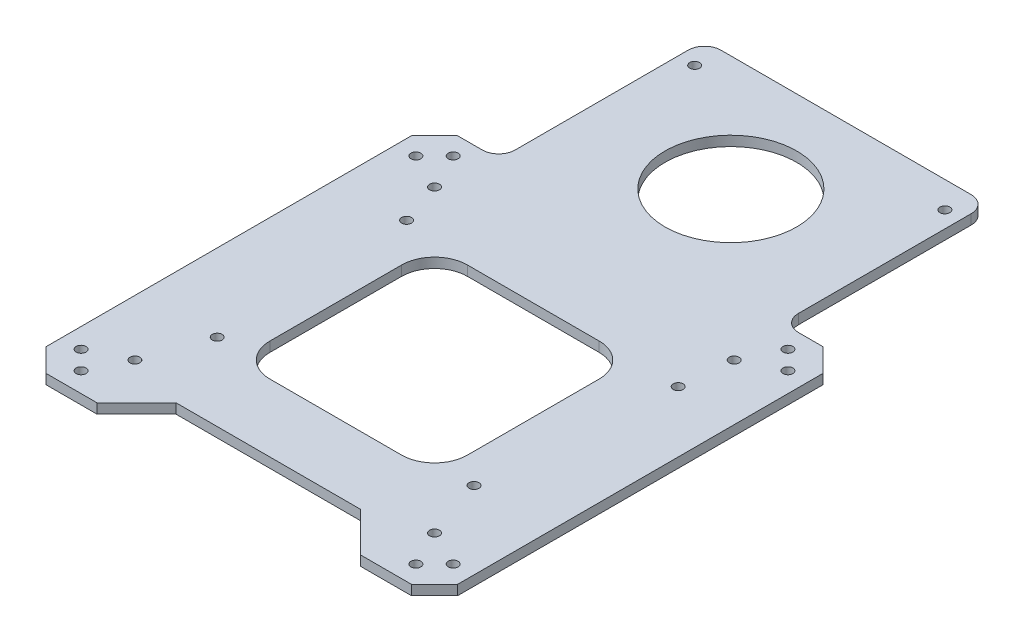
from build123d import *

# Parameters (mm, degrees)
SKETCH_1_R          = 1.5
EXTRUDE_1_DEPTH     = 3
CHAMFER_1_SIZE      = 7
FILLET_1_R          = 5
SKETCH_3_W          = 60
SKETCH_3_H          = 60
SKETCH_3_R          = 1.5
SKETCH_3_R_2        = 20
SKETCH_3_W_2        = 80
SKETCH_3_H_2        = 12
CUT_EXTRUDE_1_DEPTH = 3
FILLET_3_R          = 10
CHAMFER_2_SIZE      = 12
SKETCH_4_R          = 1.5
CUT_EXTRUDE_2_DEPTH = 10


with BuildPart() as part:
    # 草图1 → 凸台-拉伸1 (new body)
    with BuildSketch(Plane(origin=(0, 0, 0), x_dir=(1, 0, 0), z_dir=(0, 1, 0))):
        Polygon((-62.5, 62.5), (-62.5, -62.5), (62.5, -62.5), (62.5, 62.5), (43, 62.5), (43, 125), (-43, 125), (-43, 62.5), align=None)
        with Locations(Location((-56.5, -50.843145751, 0), (0, 0, 270))):
            Circle(SKETCH_1_R, mode=Mode.SUBTRACT)
        with Locations(Location((-50.843145751, -56.5, 0), (0, 0, 270))):
            Circle(SKETCH_1_R, mode=Mode.SUBTRACT)
        with Locations(Location((50.843145751, -56.5, 0), (0, 0, 270))):
            Circle(SKETCH_1_R, mode=Mode.SUBTRACT)
        with Locations(Location((56.5, -50.843145751, 0), (0, 0, 270))):
            Circle(SKETCH_1_R, mode=Mode.SUBTRACT)
        with Locations(Location((-56.5, 50.843145751, 0), (0, 0, 270))):
            Circle(SKETCH_1_R, mode=Mode.SUBTRACT)
        with Locations(Location((-50.843145751, 56.5, 0), (0, 0, 270))):
            Circle(SKETCH_1_R, mode=Mode.SUBTRACT)
        with Locations(Location((56.5, 50.843145751, 0), (0, 0, 270))):
            Circle(SKETCH_1_R, mode=Mode.SUBTRACT)
        with Locations(Location((50.843145751, 56.5, 0), (0, 0, 270))):
            Circle(SKETCH_1_R, mode=Mode.SUBTRACT)
        with Locations(Location((38, 117, 0), (0, 0, 270))):
            Circle(SKETCH_1_R, mode=Mode.SUBTRACT)
        with Locations(Location((-38, 117, 0), (0, 0, 270))):
            Circle(SKETCH_1_R, mode=Mode.SUBTRACT)
    extrude(amount=EXTRUDE_1_DEPTH)

    # 倒角1
    chamfer_1_edges = [part.edges().sort_by_distance(p)[0] for p in [
        (-62.5, 1.5, 62.5),
        (-62.5, 1.5, -62.5),
        (62.5, 1.5, -62.5),
        (62.5, 1.5, 62.5),
    ]]
    chamfer(chamfer_1_edges, length=CHAMFER_1_SIZE)

    # 圆角1
    fillet_1_edges = [part.edges().sort_by_distance(p)[0] for p in [
        (-43, 1.5, -62.5),
        (-43, 1.5, -125),
        (43, 1.5, -125),
        (43, 1.5, -62.5),
    ]]
    fillet(fillet_1_edges, radius=FILLET_1_R)

    # 草图3 → 切除-拉伸1 (cut)
    with BuildSketch(Plane(origin=(0, 3, 0), x_dir=(1, 0, 0), z_dir=(0, 1, 0))):
        Rectangle(SKETCH_3_W, SKETCH_3_H)
        with Locations(Location((-45.5, 45.5, 0), (0, 0, 270))):
            Circle(SKETCH_3_R)
        with Locations(Location((45.5, 45.5, 0), (0, 0, 270))):
            Circle(SKETCH_3_R)
        with Locations(Location((45.5, -45.5, 0), (0, 0, 270))):
            Circle(SKETCH_3_R)
        with Locations(Location((-45.5, -45.5, 0), (0, 0, 270))):
            Circle(SKETCH_3_R)
        with Locations(Location((0, 90, 0), (0, 0, 270))):
            Circle(SKETCH_3_R_2)
        with Locations((0, -56.5)):
            Rectangle(SKETCH_3_W_2, SKETCH_3_H_2)
    extrude(amount=-CUT_EXTRUDE_1_DEPTH, mode=Mode.SUBTRACT)

    # 圆角3
    fillet_3_edges = [part.edges().sort_by_distance(p)[0] for p in [
        (30, 1.5, 30),
        (-30, 1.5, 30),
        (-30, 1.5, -30),
        (30, 1.5, -30),
    ]]
    fillet(fillet_3_edges, radius=FILLET_3_R)

    # 倒角2
    chamfer_2_edges = [part.edges().sort_by_distance(p)[0] for p in [
        (40, 1.5, 50.5),
        (-40, 1.5, 50.5),
    ]]
    chamfer(chamfer_2_edges, length=CHAMFER_2_SIZE - 0.0001)  # a hair under: the kernel refuses the full size

    # 草图4 → 切除-拉伸2 (cut)
    with BuildSketch(Plane(origin=(0, 3, 0), x_dir=(1, 0, 0), z_dir=(0, 1, 0))):
        with Locations(Location((-41, 32.5, 0), (0, 0, 270))):
            Circle(SKETCH_4_R)
        with Locations(Location((44, 30, 0), (0, 0, 270))):
            Circle(SKETCH_4_R)
        with Locations(Location((-39, -27, 0), (0, 0, 270))):
            Circle(SKETCH_4_R)
        with Locations(Location((39, -27, 0), (0, 0, 270))):
            Circle(SKETCH_4_R)
    extrude(amount=-CUT_EXTRUDE_2_DEPTH, mode=Mode.SUBTRACT)


solid = part.part
